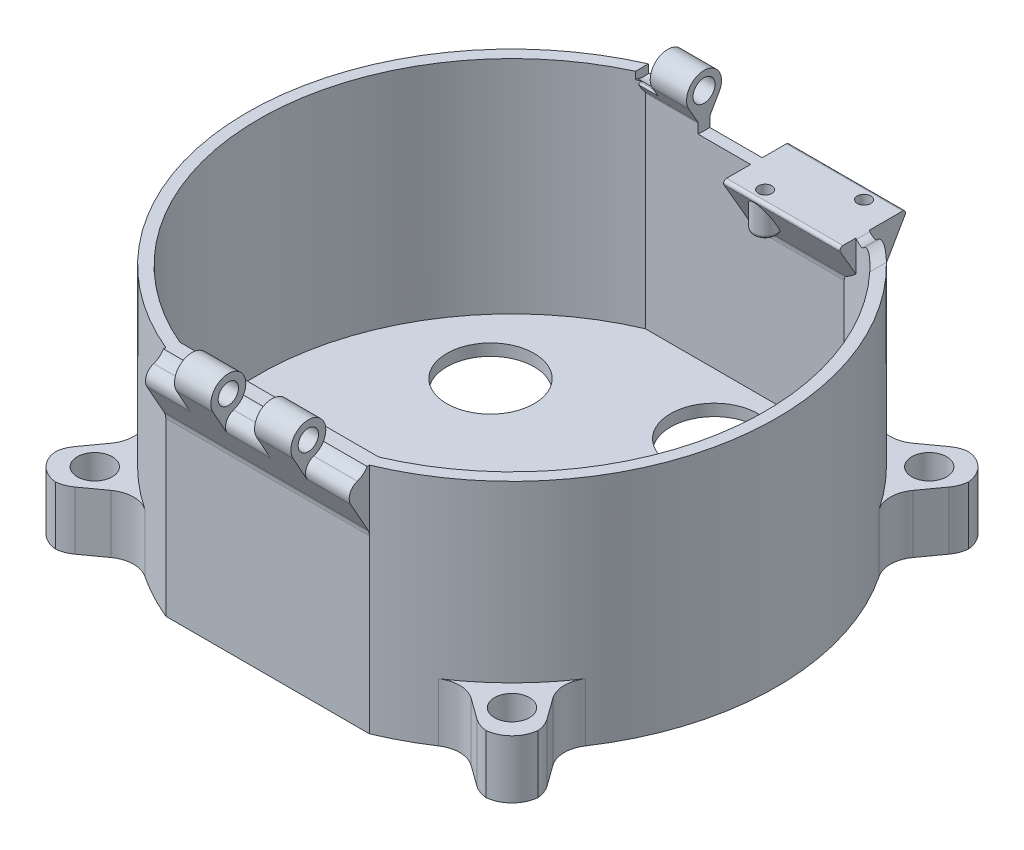
from build123d import *

# Parameters (mm, degrees)
BOSS_EXTRUDE1_DEPTH      = 40
SHELL1_T                 = -2
SKETCH2_R                = 3
SKETCH2_R_2              = 7.5
CUT_EXTRUDE1_DEPTH       = 2
SKETCH3_R                = 3
BOSS_EXTRUDE2_DEPTH      = 10
FILLET1_R                = 5
CIRPATTERN1_OUTLINE_R    = 3
CIRPATTERN1_DEPTH        = 10
BOSS_EXTRUDE3_DEPTH      = 17.5
BOSS_EXTRUDE3_DEPTH_BACK = 17.5
SKETCH4_R                = 1.75
FILLET4_R                = 5
CUT_EXTRUDE2_START       = -7.5
CUT_EXTRUDE2_DEPTH       = 7.5
LPATTERN1_COUNT          = 3
LPATTERN1_PITCH          = 13.75
FILLET2_R                = 2
BOSS_EXTRUDE4_DEPTH      = 17.5
CUT_EXTRUDE3_DEPTH       = 21.25
CUT_EXTRUDE3_DEPTH_BACK  = 6.5
SKETCH7_W                = 11
SKETCH7_H                = 12
SKETCH9_R                = 1.9
CUT_EXTRUDE4_DEPTH       = 11
BOSS_EXTRUDE5_DEPTH      = 27.5
BOSS_EXTRUDE6_REACH      = 112.229
SKETCH11_W               = 3.5
SKETCH11_H               = 8.660254038
FILLET5_R                = 2
SKETCH12_R               = 2
BOSS_EXTRUDE7_DEPTH      = 6
SKETCH13_R               = 1.15
CUT_EXTRUDE6_DEPTH       = 6
FILLET7_R                = 0.5
SKETCH14_W               = 7
SKETCH14_H               = 10
CUT_EXTRUDE7_DEPTH       = 7.5
CUT_EXTRUDE8_DEPTH       = 0.75
CUT_EXTRUDE8_DEPTH_BACK  = 3.25
FILLET6_R                = 0.25
SKETCH16_W               = 7
SKETCH16_H               = 10
CUT_EXTRUDE9_DEPTH       = 1.5
CUT_EXTRUDE10_REACH      = 112.229
CUT_EXTRUDE10_END_RADIUS = 43.5
FILLET8_R                = 10


# Read off the part's stored shape, not the designer's step: CirPattern1
with BuildPart() as part:
    # Sketch1 → Boss-Extrude1 (new body)
    with BuildSketch(Plane(origin=(0, 0, 0), x_dir=(1, 0, 0), z_dir=(0, 1, 0))):
        with BuildLine():
            Line((-17.5, 42), (17.5, 42))
            ThreePointArc((17.5, 42), (45.5, 0), (17.5, -42))
            Line((17.5, -42), (-17.5, -42))
            ThreePointArc((-17.5, -42), (-45.5, 0), (-17.5, 42))
        make_face()
    extrude(amount=BOSS_EXTRUDE1_DEPTH)

    # Shell1
    shell1_openings = [part.faces().sort_by_distance(p)[0] for p in [
        (0, 40, 0),
    ]]
    offset(amount=SHELL1_T, openings=shell1_openings, kind=Kind.INTERSECTION)

    # Sketch2 → Cut-Extrude1 (cut)
    with BuildSketch(Plane(origin=(0, 2, 0), x_dir=(1, 0, 0), z_dir=(0, 1, 0))):
        with Locations(Location((0, 0, 0), (0, 0, 270))):
            Circle(SKETCH2_R)
        with Locations(Location((5.20944533, 29.54423259, 0), (0, 0, 270))):
            Circle(SKETCH2_R_2)
        with Locations(Location((28.190778624, 10.2606043, 0), (0, 0, 270))):
            Circle(SKETCH2_R_2)
        with Locations(Location((22.981333294, -19.283628291, 0), (0, 0, 270))):
            Circle(SKETCH2_R_2)
        with Locations(Location((-5.20944533, -29.54423259, 0), (0, 0, 270))):
            Circle(SKETCH2_R_2)
        with Locations(Location((-28.190778624, -10.2606043, 0), (0, 0, 270))):
            Circle(SKETCH2_R_2)
        with Locations(Location((-22.981333294, 19.283628291, 0), (0, 0, 270))):
            Circle(SKETCH2_R_2)
    extrude(amount=-CUT_EXTRUDE1_DEPTH, mode=Mode.SUBTRACT)

    # Sketch3 → Boss-Extrude2 (add)
    with BuildSketch(Plane.XZ):
        with BuildLine():
            Line((-35.850313806, 28.017940681), (-41.507168056, 35.850313806))
            Line((-41.507168056, 35.850313806), (-41.507168056, 41.507168056))
            Line((-41.507168056, 41.507168056), (-35.850313806, 41.507168056))
            Line((-35.850313806, 41.507168056), (-28.017940681, 35.850313806))
            ThreePointArc((-28.017940681, 35.850313806), (-32.173358544, 32.173358544), (-35.850313806, 28.017940681))
        make_face()
        with Locations(Location((-35.850313806, 35.850313806, 0), (0, 0, 270))):
            Circle(SKETCH3_R, mode=Mode.SUBTRACT)
    extrude(amount=-BOSS_EXTRUDE2_DEPTH)

    # Fillet1
    # the kernel refuses this fillet: 5 mm, written as the material it adds along each edge
    with BuildSketch(Plane(origin=(-28.017940681, 0, 35.850313806), x_dir=(0.8105373937900577, 0, 0.585686890128182), z_dir=(0, 1, 0))) as fillet1_piece_1:
        with BuildLine():
            CenterArc((3.613249721, -4.996457194), FILLET1_R, 92.157009058, 69.532849002)
            Line((-1.133599694, -3.425654648), (0, 0))
            ThreePointArc((0, 0), (1.712529816, -0.032239536), (3.425059631, 0))
        make_face()
    extrude(amount=10)
    with BuildSketch(Plane(origin=(-35.850313806, 0, 28.017940681), x_dir=(-0.5856868901281832, 0, -0.8105373937900566), z_dir=(0, 1, 0))) as fillet1_piece_2:
        with BuildLine():
            CenterArc((3.613249721, 4.996457194), FILLET1_R, 198.31014194, 69.532849002)
            Line((-1.133599694, 3.425654648), (0, 0))
            ThreePointArc((0, 0), (1.712529816, 0.032239536), (3.425059631, 0))
        make_face()
    extrude(amount=10)
    # the kernel refuses this fillet: 5 mm, written as the material it takes off along each edge
    with BuildSketch(Plane(origin=(-41.507168056, -12.5, 41.507168056), x_dir=(1, 0, 0), z_dir=(0, 1, 0))) as fillet1_2_piece_1:
        with BuildLine():
            CenterArc((FILLET1_R, FILLET1_R), FILLET1_R, 180, 90)
            Line((0, FILLET1_R), (0, 0))
            Line((0, 0), (FILLET1_R, 0))
        make_face()
    extrude(amount=35, mode=Mode.SUBTRACT)
    with BuildSketch(Plane(origin=(-35.850313806, -4.042007545, 41.507168056), x_dir=(0.8106723345515203, 0, -0.5855000990544645), z_dir=(0, 1, 0)), Plane(origin=(-41.507168056, -4.042007545, 35.850313806), x_dir=(0, 0, 1), z_dir=(0, 1, 0))) as fillet1_2_piece_2:
        with BuildLine():
            CenterArc((FILLET1_R * 0.323360603618, FILLET1_R), FILLET1_R, 234.161672423, 35.838327577)
            Line((-FILLET1_R * 0.262139495437, FILLET1_R * 0.189327665448), (0, 0))
            Line((0, 0), (FILLET1_R * 0.323360603618, 0))
        make_face()
    extrude(amount=18.08401509, mode=Mode.SUBTRACT)

    # CirPattern1 outline → CirPattern1 (add)
    # profile 1 of 3: a face of its own
    with BuildSketch(Plane(origin=(0, 0, 0), x_dir=(1, 0, 0), z_dir=(0, 1, 0))):
        with BuildLine():
            ThreePointArc((35.850313806, -28.017940681), (32.173358544, -32.173358544), (28.017940681, -35.850313806))
            Line((28.017940681, -35.850313806), (34.539616329, -40.560529728))
            ThreePointArc((34.539616329, -40.560529728), (35.701909685, -41.185206507), (36.98714244, -41.484077196))
            ThreePointArc((36.98714244, -41.484077196), (40.042701962, -40.042701962), (41.484077196, -36.98714244))
            ThreePointArc((41.484077196, -36.98714244), (41.185206507, -35.701909685), (40.560529728, -34.539616329))
            Line((40.560529728, -34.539616329), (35.850313806, -28.017940681))
        make_face()
        with Locations((35.850313806, -35.850313806)):
            Circle(CIRPATTERN1_OUTLINE_R, mode=Mode.SUBTRACT)
    # profile 2 of 3: a face of its own
    with BuildSketch(Plane(origin=(0, 0, 0), x_dir=(1, 0, 0), z_dir=(0, 1, 0))):
        with BuildLine():
            ThreePointArc((28.017940681, 35.850313806), (32.173358544, 32.173358544), (35.850313806, 28.017940681))
            Line((35.850313806, 28.017940681), (40.560529728, 34.539616329))
            ThreePointArc((40.560529728, 34.539616329), (41.185206507, 35.701909685), (41.484077196, 36.98714244))
            ThreePointArc((41.484077196, 36.98714244), (40.042701962, 40.042701962), (36.98714244, 41.484077196))
            ThreePointArc((36.98714244, 41.484077196), (35.701909685, 41.185206507), (34.539616329, 40.560529728))
            Line((34.539616329, 40.560529728), (28.017940681, 35.850313806))
        make_face()
        with Locations((35.850313806, 35.850313806)):
            Circle(CIRPATTERN1_OUTLINE_R, mode=Mode.SUBTRACT)
    # profile 3 of 3: a face of its own
    with BuildSketch(Plane(origin=(0, 0, 0), x_dir=(1, 0, 0), z_dir=(0, 1, 0))):
        with BuildLine():
            ThreePointArc((-25.241801774, 37.85632633), (-28.109161878, 37.01723716), (-30.94312664, 37.963000518))
            Line((-30.94312664, 37.963000518), (-34.539616329, 40.560529728))
            ThreePointArc((-34.539616329, 40.560529728), (-35.701909685, 41.185206507), (-36.98714244, 41.484077196))
            ThreePointArc((-36.98714244, 41.484077196), (-40.042701962, 40.042701962), (-41.484077196, 36.98714244))
            ThreePointArc((-41.484077196, 36.98714244), (-41.185206507, 35.701909685), (-40.560529728, 34.539616329))
            Line((-40.560529728, 34.539616329), (-37.963000518, 30.94312664))
            ThreePointArc((-37.963000518, 30.94312664), (-37.01723716, 28.109161878), (-37.85632633, 25.241801774))
            ThreePointArc((-37.85632633, 25.241801774), (-32.173358544, 32.173358544), (-25.241801774, 37.85632633))
        make_face()
        with Locations((-35.850313806, 35.850313806)):
            Circle(CIRPATTERN1_OUTLINE_R, mode=Mode.SUBTRACT)
    extrude(amount=CIRPATTERN1_DEPTH)

    # Sketch4 → Boss-Extrude3 (add, two sides: drawn at the far end of the back side and taken through both)
    with BuildSketch(Plane(origin=(0, 0, 0), x_dir=(0, 0, -1), z_dir=(1, 0, 0)).offset(-BOSS_EXTRUDE3_DEPTH_BACK)):
        with BuildLine():
            Line((-42, 30), (-47.598076211, 40))
            ThreePointArc((-47.598076211, 40), (-45, 44.5), (-42.401923789, 40))
            Line((-42.401923789, 40), (-42, 40))
            Line((-42, 40), (-42, 30))
        make_face()
        with Locations((-45, 41.5)):
            Circle(SKETCH4_R, mode=Mode.SUBTRACT)
    extrude(amount=BOSS_EXTRUDE3_DEPTH + BOSS_EXTRUDE3_DEPTH_BACK)

    # Fillet4
    fillet4_edges = [part.edges().sort_by_distance(p)[0] for p in [
        (35.850313806, 5, 28.017940681),
        (28.017940681, 5, 35.850313806),
        (28.017940681, 5, -35.850313806),
        (35.850313806, 5, -28.017940681),
    ]]
    fillet(fillet4_edges, radius=FILLET4_R)

    # Sketch5 → Cut-Extrude2 (cut)
    with BuildSketch(Plane(origin=(17.5, 0, 0), x_dir=(0, 0, -1), z_dir=(1, 0, 0)).offset(CUT_EXTRUDE2_START)):
        with BuildLine():
            Line((-45, 38.5), (-46.75836478, 38.5))
            Line((-46.75836478, 38.5), (-47.598076211, 40))
            ThreePointArc((-47.598076211, 40), (-43.5, 44.098076211), (-45, 38.5))
        make_face()
    cut_extrude2 = extrude(amount=CUT_EXTRUDE2_DEPTH, mode=Mode.SUBTRACT)

    # LPattern1: Cut-Extrude2 ×3
    with Locations(*[(-i * LPATTERN1_PITCH, 0, 0) for i in range(1, LPATTERN1_COUNT)]):
        add(cut_extrude2, mode=Mode.SUBTRACT)

    # Fillet2
    # the kernel refuses this fillet: 2 mm, written as the material it adds along each edge
    with BuildSketch(Plane(origin=(17.5, 30, 42), x_dir=(0, -1, 0), z_dir=(-1, 0, 0))) as fillet2_piece_1:
        with BuildLine():
            CenterArc((FILLET2_R * 0.260857323782, FILLET2_R), FILLET2_R, 240.759565412, 29.240434588)
            Line((-FILLET2_R * 0.227618249499, FILLET2_R * 0.127422430779), (0, 0))
            Line((0, 0), (FILLET2_R * 0.260857323782, 0))
        make_face()
    extrude(amount=35)
    # the kernel refuses this fillet: 2 mm, written as the material it takes off along each edge
    with BuildSketch(Plane(origin=(-25.350547061, 38.5, 46.75836478), x_dir=(0, 0.05313751260987953, -0.9985872043810871), z_dir=(1, 0, 0)), Plane(origin=(10, 38.5, 46.75836478), x_dir=(0, 0.05313751260987953, -0.9985872043810871), z_dir=(1, 0, 0))) as fillet2_2_piece_1:
        with BuildLine():
            CenterArc((3.180754144, -1.934884322), FILLET2_R, 104.660568839, 101.533875954)
            Line((1.3861518, -2.817722033), (1.206691565, -2.906005804))
            Line((1.206691565, -2.906005804), (-0.179460234, -0.088283771))
            Line((-0.179460234, -0.088283771), (0.010627503, 0.199717441))
            ThreePointArc((0.010627503, 0.199717441), (1.766508072, 0.10628231), (2.623951288, 0.193488432))
            Line((2.623951288, 0.193488432), (2.67456973, 0))
        make_face()
    extrude(amount=15.350547061, mode=Mode.SUBTRACT)
    with BuildSketch(Plane(origin=(-25.350547061, 38.5, 46.75836478), x_dir=(0, 0.05313751260987953, -0.9985872043810871), z_dir=(1, 0, 0))) as fillet2_2_piece_2_section:
        with BuildLine():
            CenterArc((3.180754144, -1.934884322), FILLET2_R, 104.660568839, 101.533875954)
            Line((1.3861518, -2.817722033), (1.206691565, -2.906005804))
            Line((1.206691565, -2.906005804), (-0.179460234, -0.088283771))
            Line((-0.179460234, -0.088283771), (0.010627503, 0.199717441))
            ThreePointArc((0.010627503, 0.199717441), (1.766508072, 0.10628231), (2.623951288, 0.193488432))
            Line((2.623951288, 0.193488432), (2.67456973, 0))
        make_face()
    fillet2_2_piece_2 = extrude(amount=23.201094122, mode=Mode.PRIVATE)
    fillet2_2_piece_2 = split(fillet2_2_piece_2, bisect_by=Plane(origin=(-3.75, 37.472197508, 45.343506313), z_dir=(1, 0, 0)), keep=Keep.TOP, mode=Mode.PRIVATE)
    add(fillet2_2_piece_2, mode=Mode.SUBTRACT)
    with BuildSketch(Plane(origin=(-11.600547061, 38.5, 46.75836478), x_dir=(0, 0.05313751260987953, -0.9985872043810871), z_dir=(1, 0, 0))) as fillet2_2_piece_3_section:
        with BuildLine():
            CenterArc((3.180754144, -1.934884322), FILLET2_R, 104.660568839, 101.533875954)
            Line((1.3861518, -2.817722033), (1.206691565, -2.906005804))
            Line((1.206691565, -2.906005804), (-0.179460234, -0.088283771))
            Line((-0.179460234, -0.088283771), (0.010627503, 0.199717441))
            ThreePointArc((0.010627503, 0.199717441), (1.766508072, 0.10628231), (2.623951288, 0.193488432))
            Line((2.623951288, 0.193488432), (2.67456973, 0))
        make_face()
    fillet2_2_piece_3 = extrude(amount=23.201094122, mode=Mode.PRIVATE)
    fillet2_2_piece_3 = split(fillet2_2_piece_3, bisect_by=Plane(origin=(-10, 37.472197508, 45.343506313), z_dir=(-1, 0, 0)), keep=Keep.TOP, mode=Mode.PRIVATE)
    add(fillet2_2_piece_3, mode=Mode.SUBTRACT)
    with BuildSketch(Plane(origin=(-3.75, 38.5, 46.75836478), x_dir=(0, 0.05313751260987953, -0.9985872043810871), z_dir=(1, 0, 0))) as fillet2_2_piece_4:
        with BuildLine():
            CenterArc((3.180754144, -1.934884322), FILLET2_R, 104.660568839, 101.533875954)
            Line((1.3861518, -2.817722033), (1.206691565, -2.906005804))
            Line((1.206691565, -2.906005804), (-0.179460234, -0.088283771))
            Line((-0.179460234, -0.088283771), (0.010627503, 0.199717441))
            ThreePointArc((0.010627503, 0.199717441), (1.766508072, 0.10628231), (2.623951288, 0.193488432))
            Line((2.623951288, 0.193488432), (2.67456973, 0))
        make_face()
    extrude(amount=7.5, mode=Mode.SUBTRACT)
    with BuildSketch(Plane(origin=(-11.600547061, 38.5, 46.75836478), x_dir=(0, 0.05313751260987953, -0.9985872043810871), z_dir=(1, 0, 0))) as fillet2_2_piece_5_section:
        with BuildLine():
            CenterArc((3.180754144, -1.934884322), FILLET2_R, 104.660568839, 101.533875954)
            Line((1.3861518, -2.817722033), (1.206691565, -2.906005804))
            Line((1.206691565, -2.906005804), (-0.179460234, -0.088283771))
            Line((-0.179460234, -0.088283771), (0.010627503, 0.199717441))
            ThreePointArc((0.010627503, 0.199717441), (1.766508072, 0.10628231), (2.623951288, 0.193488432))
            Line((2.623951288, 0.193488432), (2.67456973, 0))
        make_face()
    fillet2_2_piece_5 = extrude(amount=23.201094122, mode=Mode.PRIVATE)
    fillet2_2_piece_5 = split(fillet2_2_piece_5, bisect_by=Plane(origin=(10, 37.472197508, 45.343506313), z_dir=(1, 0, 0)), keep=Keep.TOP, mode=Mode.PRIVATE)
    add(fillet2_2_piece_5, mode=Mode.SUBTRACT)
    with BuildSketch(Plane(origin=(2.149452939, 38.5, 46.75836478), x_dir=(0, 0.05313751260987953, -0.9985872043810871), z_dir=(1, 0, 0))) as fillet2_2_piece_6_section:
        with BuildLine():
            CenterArc((3.180754144, -1.934884322), FILLET2_R, 104.660568839, 101.533875954)
            Line((1.3861518, -2.817722033), (1.206691565, -2.906005804))
            Line((1.206691565, -2.906005804), (-0.179460234, -0.088283771))
            Line((-0.179460234, -0.088283771), (0.010627503, 0.199717441))
            ThreePointArc((0.010627503, 0.199717441), (1.766508072, 0.10628231), (2.623951288, 0.193488432))
            Line((2.623951288, 0.193488432), (2.67456973, 0))
        make_face()
    fillet2_2_piece_6 = extrude(amount=23.201094122, mode=Mode.PRIVATE)
    fillet2_2_piece_6 = split(fillet2_2_piece_6, bisect_by=Plane(origin=(3.75, 37.472197508, 45.343506313), z_dir=(-1, 0, 0)), keep=Keep.TOP, mode=Mode.PRIVATE)
    add(fillet2_2_piece_6, mode=Mode.SUBTRACT)

    # Sketch6 → Boss-Extrude4 (add)
    with BuildSketch(Plane(origin=(0, 0, 0), x_dir=(0, 0, -1), z_dir=(1, 0, 0))):
        with BuildLine():
            Line((43.598076211, 40), (42, 37.232050808))
            Line((42, 37.232050808), (42, 40))
            Line((42, 40), (42.166190379, 40))
            ThreePointArc((42.166190379, 40), (41, 43.4), (39.833809621, 40))
            Line((39.833809621, 40), (40, 40))
            Line((40, 40), (40, 37.232050808))
            Line((40, 37.232050808), (38.401923789, 40))
            ThreePointArc((38.401923789, 40), (41, 44.5), (43.598076211, 40))
        make_face()
    extrude(amount=-BOSS_EXTRUDE4_DEPTH)

    # Sketch7 → Cut-Extrude3 (cut, two sides: drawn at the far end of the back side and taken through both)
    with BuildSketch(Plane(origin=(0, 0, 0), x_dir=(0, 0, -1), z_dir=(1, 0, 0)).offset(-CUT_EXTRUDE3_DEPTH_BACK)):
        with Locations((41, 41.5)):
            Rectangle(SKETCH7_W, SKETCH7_H)
    extrude(amount=CUT_EXTRUDE3_DEPTH + CUT_EXTRUDE3_DEPTH_BACK, mode=Mode.SUBTRACT)

    # Sketch9 → Cut-Extrude4 (cut)
    with BuildSketch(Plane(origin=(-6.5, 0, 0), x_dir=(0, 0, -1), z_dir=(1, 0, 0))):
        with Locations((41, 41.5)):
            Circle(SKETCH9_R)
    extrude(amount=-CUT_EXTRUDE4_DEPTH, mode=Mode.SUBTRACT)

    # Sketch8 → Boss-Extrude5 (add)
    with BuildSketch(Plane(origin=(-6.5, 0, 0), x_dir=(0, 0, -1), z_dir=(1, 0, 0))):
        Polygon((42, 26.839745962), (47, 35.5), (42, 35.5), align=None)
        Polygon((40, 26.839745962), (35, 35.5), (40, 35.5), align=None)
    extrude(amount=BOSS_EXTRUDE5_DEPTH)

    # Sketch11 → Boss-Extrude6 (add, up to next)
    with BuildSketch(Plane.XY.offset(-42), mode=Mode.PRIVATE) as boss_extrude6_sk1:
        with Locations((19.25, 31.169872981)):
            Rectangle(SKETCH11_W, SKETCH11_H)
    boss_extrude6_tool1 = extrude(boss_extrude6_sk1.sketch, amount=BOSS_EXTRUDE6_REACH, mode=Mode.PRIVATE) - part.part
    add(boss_extrude6_tool1.solids().sort_by_distance((19.25, 31.169873, -42))[0])

    # Fillet5
    fillet5_edges = [part.edges().sort_by_distance(p)[0] for p in [
        (5.5, 26.839745962, -42),
        (5.297660499, 26.839745962, -40),
    ]]
    fillet(fillet5_edges, radius=FILLET5_R)

    # Sketch12 → Boss-Extrude7 (add)
    with BuildSketch(Plane(origin=(0, 35.5, 0), x_dir=(1, 0, 0), z_dir=(0, 1, 0))):
        with Locations((16, 44.5)):
            Circle(SKETCH12_R)
        with Locations((6, 37.5)):
            Circle(SKETCH12_R)
    extrude(amount=-BOSS_EXTRUDE7_DEPTH)

    # Sketch13 → Cut-Extrude6 (cut)
    with BuildSketch(Plane.XZ.offset(-29.5)):
        with Locations(Location((6, -37.5, 0), (0, 0, 303.033789208))):
            Circle(SKETCH13_R)
        with Locations(Location((16, -44.5, 0), (0, 0, 123.033789208))):
            Circle(SKETCH13_R)
    extrude(amount=-CUT_EXTRUDE6_DEPTH, mode=Mode.SUBTRACT)

    # Fillet7
    fillet7_edges = [part.edges().sort_by_distance(p)[0] for p in [
        (7.25, 35.5, -47),
        (7.25, 35.5, -35),
        (6, 29.5, -35.5),
        (16, 29.5, -46.5),
        (-11.797660499, 37.232050808, -40),
        (-12, 37.232050808, -42),
    ]]
    fillet(fillet7_edges, radius=FILLET7_R)

    # Sketch14 → Cut-Extrude7 (cut)
    with BuildSketch(Plane.ZY.offset(6.5)):
        with Locations((-45.5, 30.5)):
            Rectangle(SKETCH14_W, SKETCH14_H)
        with Locations((-36.5, 30.5)):
            Rectangle(SKETCH14_W, SKETCH14_H)
    extrude(amount=-CUT_EXTRUDE7_DEPTH, mode=Mode.SUBTRACT)

    # Sketch15 → Cut-Extrude8 (cut, two sides: drawn at the far end of the back side and taken through both)
    with BuildSketch(Plane.ZY.offset(17.5).offset(-CUT_EXTRUDE8_DEPTH_BACK)):
        with BuildLine():
            Line((-42, 38.671572875), (-42.832531755, 38.674038106))
            Line((-42.832531755, 38.674038106), (-43.598076211, 40))
            ThreePointArc((-43.598076211, 40), (-41, 44.5), (-38.401923789, 40))
            Line((-38.401923789, 40), (-39.129476255, 38.739842163))
            Line((-39.129476255, 38.739842163), (-39.824615503, 38.739842163))
            ThreePointArc((-39.824615503, 38.739842163), (-40.905898436, 38.501476214), (-42, 38.671572875))
        make_face()
    extrude(amount=CUT_EXTRUDE8_DEPTH + CUT_EXTRUDE8_DEPTH_BACK, mode=Mode.SUBTRACT)

    # Fillet6
    fillet6_edges = [part.edges().sort_by_distance(p)[0] for p in [
        (19.25, 26.839745962, -42),
        (21, 26.839745962, -41.181984541),
        (-15.875, 38.739842163, -39.129476255),
        (-15.875, 38.674038106, -42.832531755),
    ]]
    fillet(fillet6_edges, radius=FILLET6_R)

    # Sketch16 → Cut-Extrude9 (cut)
    with BuildSketch(Plane(origin=(-6.5, 0, 0), x_dir=(0, 0, -1), z_dir=(1, 0, 0))):
        with Locations((41, 40.5)):
            Rectangle(SKETCH16_W, SKETCH16_H)
    extrude(amount=-CUT_EXTRUDE9_DEPTH, mode=Mode.SUBTRACT)

    # Cut-Extrude10: up to this cylinder (the profile starts outside it)
    cut_extrude10_end = Plane(origin=(0, 38.090141, 0), z_dir=(0, -1, 0)) * Cylinder(CUT_EXTRUDE10_END_RADIUS, 312.458, mode=Mode.PRIVATE)
    # Sketch17 → Cut-Extrude10 (cut, up to the surface)
    with BuildSketch(Plane(origin=(0, 0, -42), x_dir=(-1, 0, 0), z_dir=(0, 0, -1)), mode=Mode.PRIVATE) as cut_extrude10_sk1:
        with BuildLine():
            Line((-25.75, 40), (-21.25, 40))
            Line((-21.25, 40), (-21.25, 35.5))
            ThreePointArc((-21.25, 35.5), (-24.431980515, 36.818019485), (-25.75, 40))
        make_face()
    cut_extrude10_tool1 = extrude(cut_extrude10_sk1.sketch, amount=-CUT_EXTRUDE10_REACH, mode=Mode.PRIVATE) - cut_extrude10_end
    add(cut_extrude10_tool1.solids().sort_by_distance((23.159859, 38.090141, -42))[0], mode=Mode.SUBTRACT)

    # Fillet8
    # the kernel refuses this fillet: 10 mm, written as the material it takes off along each edge
    with BuildSketch(Plane(origin=(25.75, 40, -52.512497917), x_dir=(1, 0, 0), z_dir=(0, 0, 1))) as fillet8_piece_1:
        with BuildLine():
            CenterArc((6, -10), FILLET8_R, 90, 46.397181027)
            ThreePointArc((-1.24137931, -3.103448276), (-0.321854891, -1.671258044), (0, 0))
            Line((0, 0), (6, 0))
        make_face()
    extrude(amount=32.452727525, mode=Mode.SUBTRACT)


solid = part.part
